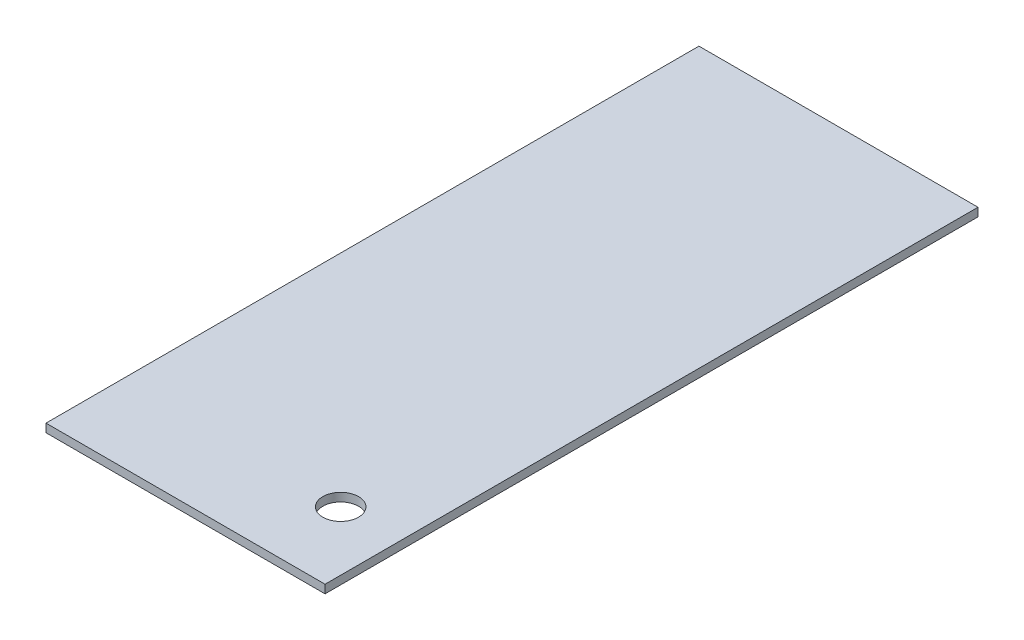
from build123d import *

# Parameters (mm, degrees)
SKETCH1_W           = 63.5
SKETCH1_H           = 148.59
BOSS_EXTRUDE1_DEPTH = 1.905
SKETCH2_R           = 4.064
CUT_EXTRUDE1_DEPTH  = 2.54


with BuildPart() as part:
    # Sketch1 → Boss-Extrude1 (new body)
    with BuildSketch(Plane(origin=(0, 0, 0), x_dir=(1, 0, 0), z_dir=(0, 1, 0))):
        with Locations((31.75, 74.295)):
            Rectangle(SKETCH1_W, SKETCH1_H)
    extrude(amount=BOSS_EXTRUDE1_DEPTH)

    # Sketch2 → Cut-Extrude1 (cut)
    with BuildSketch(Plane(origin=(0, 1.905, 0), x_dir=(1, 0, 0), z_dir=(0, 1, 0))):
        with Locations((50.038, 17.018)):
            Circle(SKETCH2_R)
    extrude(amount=-CUT_EXTRUDE1_DEPTH, mode=Mode.SUBTRACT)


solid = part.part
